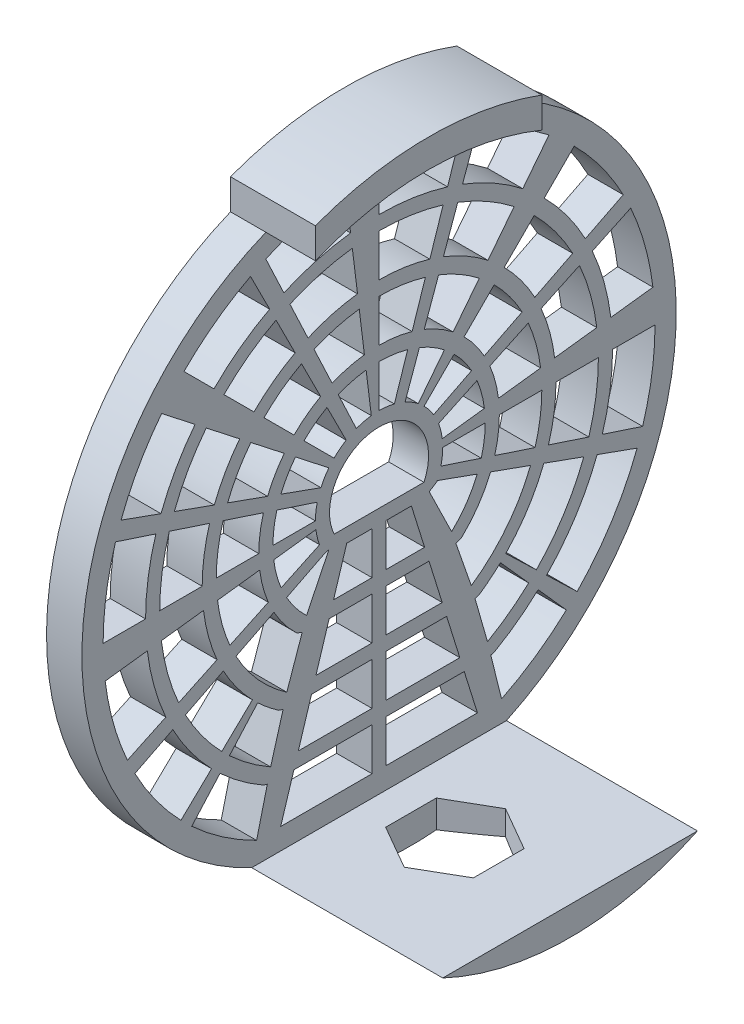
from build123d import *
from build123d.topology import SkipClean

# Parameters (mm, degrees)
EXTRUDE_START       = -8
EXTRUDE_3_DEPTH     = 16
SKETCH_4_R          = 1.5
CUT_EXTRUDE_3_DEPTH = 16
CUT_EXTRUDE_4_DEPTH = 190.330679157
EXTRUDE_START_2     = -2
EXTRUDE_4_DEPTH     = 2
EXTRUDE_START_3     = 2
EXTRUDE_5_DEPTH     = 2
CUT_EXTRUDE_START   = -2
CUT_EXTRUDE_5_DEPTH = 2
CUT_EXTRUDE_START_2 = 2
CUT_EXTRUDE_6_DEPTH = 2
EXTRUDE_6_DEPTH     = 6
SKETCH_13_R         = 20.278218111
EXTRUDE_9_DEPTH     = 2.5
EXTRUDE_10_DEPTH    = 2.5


# Read off the part's stored shape, not the designer's step: 填料-伸長3
with BuildPart() as part:
    # 填料-伸長3 outline → 填料-伸長3 (new body)
    with BuildSketch(Plane(origin=(-3, 0, 0), x_dir=(0, 0, -1), z_dir=(1, 0, 0)).offset(EXTRUDE_START)):
        with BuildLine():
            ThreePointArc((-189, -41.816711929), (-180, -43.843045968), (-171, -41.816711929))
            Line((-171, -41.816711929), (-189, -41.816711929))
        make_face()
    extrude(amount=EXTRUDE_3_DEPTH)

    # 草圖4 → 除料-伸長3 (cut)
    with BuildSketch(Plane(origin=(0, -41.816711929, 0), x_dir=(1, 0, 0), z_dir=(0, 1, 0))):
        with Locations(Location((-3.143386724, -180, 0), (0, 0, 270))):
            Circle(SKETCH_4_R)
    extrude(amount=-CUT_EXTRUDE_3_DEPTH, mode=Mode.SUBTRACT)

    # 草圖6 → 除料-伸長4 (cut, through all)
    with BuildSketch(Plane(origin=(0, -41.816711929, 0), x_dir=(1, 0, 0), z_dir=(0, 1, 0))):
        Polygon((-3.143386724, -176.420428331), (-6.243386724, -178.210214166), (-6.243386724, -181.789785834), (-3.143386724, -183.579571669), (-0.043386724, -181.789785834), (-0.043386724, -178.210214166), align=None)
    extrude(amount=-CUT_EXTRUDE_4_DEPTH, mode=Mode.SUBTRACT)

    # 草圖8 → 填料-伸長4 (add)
    with BuildSketch(Plane(origin=(-8.5, 0, 0), x_dir=(0, 0, -1), z_dir=(1, 0, 0)).offset(EXTRUDE_START_2)):
        with BuildLine():
            Line((-171, -41.816711929), (-189, -41.816711929))
            ThreePointArc((-189, -41.816711929), (-200.992879202, -22.296216192), (-188, -3.426558129))
            ThreePointArc((-188, -3.426558129), (-180, -1.843045968), (-172, -3.426558129))
            ThreePointArc((-172, -3.426558129), (-159.007120798, -22.296216192), (-171, -41.816711929))
        make_face()
    extrude(amount=EXTRUDE_4_DEPTH)

    # 草圖9 → 填料-伸長5 (add)
    with SkipClean():  # the faces are left unmerged after this step: merging them gives an invalid solid
        with BuildSketch(Plane.ZY.offset(10.5).offset(EXTRUDE_START_3)):
            with BuildLine():
                Line((171, -41.816711929), (189, -41.816711929))
                ThreePointArc((189, -41.816711929), (200.692845947, -26.421610847), (194.849242405, -7.993803563))
                ThreePointArc((194.849242405, -7.993803563), (162.837520815, -10.74142177), (171, -41.816711929))
            make_face()
            with BuildLine():
                Line((172.104683891, -37.255080469), (171.344308353, -40.316711929))
                ThreePointArc((171.344308353, -40.316711929), (163.431415463, -33.125652955), (160.5, -22.843045968))
                Line((160.5, -22.843045968), (163.5, -22.843045968))
                ThreePointArc((163.5, -22.843045968), (165.737566813, -31.139611497), (171.843393889, -37.185980701))
                Line((171.843393889, -37.185980701), (172.104683891, -37.255080469))
            make_face(mode=Mode.SUBTRACT)
            with BuildLine():
                Line((172.913939335, -33.140508969), (173.218364719, -33.235132513))
                Line((173.218364719, -33.235132513), (172.337733653, -36.316711929))
                ThreePointArc((172.337733653, -36.316711929), (166.601956703, -30.636789344), (164.5, -22.843045968))
                Line((164.5, -22.843045968), (167.5, -22.843045968))
                ThreePointArc((167.5, -22.843045968), (168.935964608, -28.660014323), (172.913939335, -33.140508969))
            make_face(mode=Mode.SUBTRACT)
            with BuildLine():
                Line((174.189084794, -29.046534057), (174.566816155, -29.195815975))
                Line((174.566816155, -29.195815975), (173.480824189, -32.316711929))
                ThreePointArc((173.480824189, -32.316711929), (169.821087439, -28.194656855), (168.5, -22.843045968))
                Line((168.5, -22.843045968), (171.5, -22.843045968))
                ThreePointArc((171.5, -22.843045968), (172.201193064, -26.223668747), (174.189084794, -29.046534057))
            make_face(mode=Mode.SUBTRACT)
            with BuildLine():
                Line((175.918326175, -24.737759347), (176.453174061, -25.079146753))
                Line((176.453174061, -25.079146753), (174.872721877, -28.316711929))
                ThreePointArc((174.872721877, -28.316711929), (173.118699762, -25.82594842), (172.5, -22.843045968))
                Line((172.5, -22.843045968), (175.5, -22.843045968))
                ThreePointArc((175.5, -22.843045968), (175.60582589, -23.813218063), (175.918326175, -24.737759347))
            make_face(mode=Mode.SUBTRACT)
            Polygon((186.01788988, -37.316711929), (186.951295427, -40.316711929), (173.048704573, -40.316711929), (173.98211012, -37.316711929), align=None, mode=Mode.SUBTRACT)
            Polygon((184.773349151, -33.316711929), (185.706754698, -36.316711929), (174.293245302, -36.316711929), (175.226650849, -33.316711929), align=None, mode=Mode.SUBTRACT)
            with BuildLine():
                ThreePointArc((199.354649957, -25.219498165), (195.909942648, -34.117961708), (188.655691647, -40.316711929))
                Line((188.655691647, -40.316711929), (187.895316109, -37.255080469))
                Line((187.895316109, -37.255080469), (188.156606111, -37.185980701))
                ThreePointArc((188.156606111, -37.185980701), (193.729337666, -31.994837447), (196.377011502, -24.853890134))
                Line((196.377011502, -24.853890134), (199.354649957, -25.219498165))
            make_face(mode=Mode.SUBTRACT)
            Polygon((183.528808422, -29.316711929), (184.462213969, -32.316711929), (175.537786031, -32.316711929), (176.471191578, -29.316711929), align=None, mode=Mode.SUBTRACT)
            with BuildLine():
                ThreePointArc((191.414280744, -24.244543417), (189.833218808, -28.806082768), (186.519175811, -32.316711929))
                Line((186.519175811, -32.316711929), (185.433183845, -29.195815975))
                Line((185.433183845, -29.195815975), (185.810915206, -29.046534057))
                ThreePointArc((185.810915206, -29.046534057), (187.577878506, -26.693468978), (188.436642289, -23.878935387))
                Line((188.436642289, -23.878935387), (191.414280744, -24.244543417))
            make_face(mode=Mode.SUBTRACT)
            Polygon((182.284267693, -25.316711929), (183.21767324, -28.316711929), (176.78232676, -28.316711929), (177.715732307, -25.316711929), align=None, mode=Mode.SUBTRACT)
            with BuildLine():
                ThreePointArc((187.444096137, -23.757066044), (186.686363387, -26.240478036), (185.127278123, -28.316711929))
                Line((185.127278123, -28.316711929), (183.546825939, -25.079146753))
                Line((183.546825939, -25.079146753), (184.081673825, -24.737759347))
                ThreePointArc((184.081673825, -24.737759347), (184.3267505, -24.079666408), (184.466457682, -23.391458013))
                Line((184.466457682, -23.391458013), (187.444096137, -23.757066044))
            make_face(mode=Mode.SUBTRACT)
            with BuildLine():
                ThreePointArc((195.38446535, -24.732020791), (192.897256595, -31.440183418), (187.662266347, -36.316711929))
                Line((187.662266347, -36.316711929), (186.781635281, -33.235132513))
                Line((186.781635281, -33.235132513), (187.086060665, -33.140508969))
                ThreePointArc((187.086060665, -33.140508969), (190.688281313, -29.324607707), (192.406826896, -24.366412761))
                Line((192.406826896, -24.366412761), (195.38446535, -24.732020791))
            make_face(mode=Mode.SUBTRACT)
            with BuildLine():
                ThreePointArc((168.33273811, -11.175784079), (165.169898236, -15.609922046), (163.622988498, -20.832201802))
                Line((163.622988498, -20.832201802), (160.645350043, -20.466593772))
                ThreePointArc((160.645350043, -20.466593772), (162.473516097, -14.294808606), (166.211417767, -9.054463735))
                Line((166.211417767, -9.054463735), (168.33273811, -11.175784079))
            make_face(mode=Mode.SUBTRACT)
            with BuildLine():
                ThreePointArc((171.161165235, -14.004211203), (168.765074421, -17.363406633), (167.593173104, -21.319679176))
                Line((167.593173104, -21.319679176), (164.61553465, -20.954071145))
                ThreePointArc((164.61553465, -20.954071145), (166.068692282, -16.048293193), (169.039844892, -11.88289086))
                Line((169.039844892, -11.88289086), (171.161165235, -14.004211203))
            make_face(mode=Mode.SUBTRACT)
            with BuildLine():
                Line((174.696699141, -17.539745109), (176.818019485, -19.661065453))
                ThreePointArc((176.818019485, -19.661065453), (175.955426792, -20.870375808), (175.533542318, -22.294633923))
                Line((175.533542318, -22.294633923), (172.555903863, -21.929025893))
                ThreePointArc((172.555903863, -21.929025893), (173.259044653, -19.555262367), (174.696699141, -17.539745109))
            make_face(mode=Mode.SUBTRACT)
            with BuildLine():
                ThreePointArc((173.98959236, -16.832638328), (172.360250606, -19.11689122), (171.563357711, -21.807156549))
                Line((171.563357711, -21.807156549), (168.585719256, -21.441548519))
                ThreePointArc((168.585719256, -21.441548519), (169.663868468, -17.80177778), (171.868272016, -14.711317984))
                Line((171.868272016, -14.711317984), (173.98959236, -16.832638328))
            make_face(mode=Mode.SUBTRACT)
            with BuildLine():
                Line((180, -15.343045968), (180, -18.343045968))
                ThreePointArc((180, -18.343045968), (178.534943305, -18.588212378), (177.229523361, -19.296997577))
                Line((177.229523361, -19.296997577), (175.382538935, -16.932965316))
                ThreePointArc((175.382538935, -16.932965316), (177.558238842, -15.751656651), (180, -15.343045968))
            make_face(mode=Mode.SUBTRACT)
            with BuildLine():
                Line((174.76687746, -16.144954562), (172.919893034, -13.780922302))
                ThreePointArc((172.919893034, -13.780922302), (176.255966224, -11.969582349), (180, -11.343045968))
                Line((180, -11.343045968), (180, -14.343045968))
                ThreePointArc((180, -14.343045968), (177.232670687, -14.806138076), (174.76687746, -16.144954562))
            make_face(mode=Mode.SUBTRACT)
            with BuildLine():
                Line((172.304231558, -12.992911548), (170.457247132, -10.628879287))
                ThreePointArc((170.457247132, -10.628879287), (174.953693606, -8.187508046), (180, -7.343045968))
                Line((180, -7.343045968), (180, -10.343045968))
                ThreePointArc((180, -10.343045968), (175.930398069, -11.024063773), (172.304231558, -12.992911548))
            make_face(mode=Mode.SUBTRACT)
            with BuildLine():
                Line((169.841585657, -9.840868534), (167.994601231, -7.476836273))
                ThreePointArc((167.994601231, -7.476836273), (173.651420988, -4.405433744), (180, -3.343045968))
                Line((180, -3.343045968), (180, -6.343045968))
                ThreePointArc((180, -6.343045968), (174.628125451, -7.241989471), (169.841585657, -9.840868534))
            make_face(mode=Mode.SUBTRACT)
            with BuildLine():
                ThreePointArc((183.473911531, -23.26958867), (183.365250389, -23.804861866), (183.174635197, -24.316711929))
                Line((183.174635197, -24.316711929), (176.825364803, -24.316711929))
                ThreePointArc((176.825364803, -24.316711929), (176.582309026, -23.597624264), (176.5, -22.843045968))
                ThreePointArc((176.5, -22.843045968), (176.506528206, -22.62937608), (176.526088469, -22.416503266))
                ThreePointArc((176.526088469, -22.416503266), (176.854220838, -21.308746954), (177.525126266, -20.368172234))
                ThreePointArc((177.525126266, -20.368172234), (177.680829831, -20.221700945), (177.845184836, -20.08500833))
                ThreePointArc((177.845184836, -20.08500833), (178.860511459, -19.533730954), (180, -19.343045968))
                ThreePointArc((180, -19.343045968), (180.213669888, -19.349574174), (180.426542702, -19.369134437))
                ThreePointArc((180.426542702, -19.369134437), (181.534299014, -19.697266806), (182.474873734, -20.368172234))
                ThreePointArc((182.474873734, -20.368172234), (182.621345023, -20.523875799), (182.758037638, -20.688230804))
                ThreePointArc((182.758037638, -20.688230804), (183.309315015, -21.703557428), (183.5, -22.843045968))
                ThreePointArc((183.5, -22.843045968), (183.493471794, -23.056715856), (183.473911531, -23.26958867))
            make_face(mode=Mode.SUBTRACT)
            with BuildLine():
                Line((185.303300859, -17.539745109), (183.181980515, -19.661065453))
                ThreePointArc((183.181980515, -19.661065453), (181.972670161, -18.79847276), (180.548412045, -18.376588286))
                Line((180.548412045, -18.376588286), (180.914020076, -15.398949831))
                ThreePointArc((180.914020076, -15.398949831), (183.287783601, -16.102090621), (185.303300859, -17.539745109))
            make_face(mode=Mode.SUBTRACT)
            with BuildLine():
                Line((187.5, -22.843045968), (184.5, -22.843045968))
                ThreePointArc((184.5, -22.843045968), (184.25483359, -21.377989273), (183.546048391, -20.072569329))
                Line((183.546048391, -20.072569329), (185.910080652, -18.225584903))
                ThreePointArc((185.910080652, -18.225584903), (187.091389317, -20.40128481), (187.5, -22.843045968))
            make_face(mode=Mode.SUBTRACT)
            with BuildLine():
                Line((191.5, -22.843045968), (188.5, -22.843045968))
                ThreePointArc((188.5, -22.843045968), (188.036907893, -20.075716655), (186.698091406, -17.609923428))
                Line((186.698091406, -17.609923428), (189.062123666, -15.762939002))
                ThreePointArc((189.062123666, -15.762939002), (190.873463619, -19.099012192), (191.5, -22.843045968))
            make_face(mode=Mode.SUBTRACT)
            with BuildLine():
                Line((188.131727984, -14.711317984), (186.01040764, -16.832638328))
                ThreePointArc((186.01040764, -16.832638328), (183.726154748, -15.203296575), (181.035889419, -14.406403679))
                Line((181.035889419, -14.406403679), (181.401497449, -11.428765224))
                ThreePointArc((181.401497449, -11.428765224), (185.041268188, -12.506914436), (188.131727984, -14.711317984))
            make_face(mode=Mode.SUBTRACT)
            with BuildLine():
                Line((195.5, -22.843045968), (192.5, -22.843045968))
                ThreePointArc((192.5, -22.843045968), (191.818982195, -18.773444037), (189.85013442, -15.147277527))
                Line((189.85013442, -15.147277527), (192.214166681, -13.300293101))
                ThreePointArc((192.214166681, -13.300293101), (194.655537922, -17.796739574), (195.5, -22.843045968))
            make_face(mode=Mode.SUBTRACT)
            with BuildLine():
                Line((199.5, -22.843045968), (196.5, -22.843045968))
                ThreePointArc((196.5, -22.843045968), (195.601056497, -17.47117142), (193.002177435, -12.684631625))
                Line((193.002177435, -12.684631625), (195.366209695, -10.837647199))
                ThreePointArc((195.366209695, -10.837647199), (198.437612224, -16.494466956), (199.5, -22.843045968))
            make_face(mode=Mode.SUBTRACT)
            with BuildLine():
                Line((190.960155108, -11.88289086), (188.838834765, -14.004211203))
                ThreePointArc((188.838834765, -14.004211203), (185.479639335, -11.608120389), (181.523366793, -10.436219073))
                Line((181.523366793, -10.436219073), (181.888974823, -7.458580618))
                ThreePointArc((181.888974823, -7.458580618), (186.794752775, -8.91173825), (190.960155108, -11.88289086))
            make_face(mode=Mode.SUBTRACT)
            with BuildLine():
                Line((193.788582233, -9.054463735), (191.66726189, -11.175784079))
                ThreePointArc((191.66726189, -11.175784079), (187.233123922, -8.012944204), (182.010844166, -6.466034466))
                Line((182.010844166, -6.466034466), (182.376452196, -3.488396011))
                ThreePointArc((182.376452196, -3.488396011), (188.548237362, -5.316562065), (193.788582233, -9.054463735))
            make_face(mode=Mode.SUBTRACT)
        extrude_5 = extrude(amount=-EXTRUDE_5_DEPTH)

    # 草圖10 → 除料-伸長5 (cut)
    with BuildSketch(Plane(origin=(-8.5, 0, 0), x_dir=(0, 0, -1), z_dir=(1, 0, 0)).offset(CUT_EXTRUDE_START)):
        with BuildLine():
            Line((-189, -41.816711929), (-171, -41.816711929))
            ThreePointArc((-171, -41.816711929), (-180, -1.843045968), (-189, -41.816711929))
        make_face()
    extrude(amount=CUT_EXTRUDE_5_DEPTH, mode=Mode.SUBTRACT)

    # 鏡射1: 填料-伸長5 across plane
    with SkipClean():  # the faces are left unmerged after this step: merging them gives an invalid solid
        add(extrude_5.mirror(Plane(origin=(-10.5, 0, 0), x_dir=(0, 0, 1), z_dir=(1, 0, 0))))

    # 草圖11 → 除料-伸長6 (cut)
    with SkipClean():  # the faces are left unmerged after this step: merging them gives an invalid solid
        with BuildSketch(Plane.ZY.offset(11).offset(CUT_EXTRUDE_START_2)):
            with BuildLine():
                ThreePointArc((189, -41.816711929), (180, -1.843045968), (171, -41.816711929))
                Line((171, -41.816711929), (189, -41.816711929))
            make_face()
        extrude(amount=-CUT_EXTRUDE_6_DEPTH, mode=Mode.SUBTRACT)

    # 草圖12 → 填料-伸長6 (add)
    with SkipClean():  # the faces are left unmerged after this step: merging them gives an invalid solid
        with BuildSketch(Plane.ZY.offset(11)):
            with BuildLine():
                Line((188, -1.279187315), (188, -3.426558129))
                ThreePointArc((188, -3.426558129), (180, -1.843045968), (172, -3.426558129))
                Line((172, -3.426558129), (172, -1.279187315))
                ThreePointArc((172, -1.279187315), (180, 0.156954032), (188, -1.279187315))
            make_face()
        extrude(amount=-EXTRUDE_6_DEPTH)

    # 草圖13 → 填料-伸長9 (add)
    with SkipClean():  # the faces are left unmerged after this step: merging them gives an invalid solid
        with BuildSketch(Plane.ZY.offset(11)):
            with Locations((180, -22.843045968)):
                Circle(SKETCH_13_R)
            with BuildLine():
                Line((189.083403464, -5.587850185), (182.32403926, -18.98962651))
                ThreePointArc((182.32403926, -18.98962651), (181.972670161, -18.79847276), (181.605714532, -18.639276131))
                Line((181.605714532, -18.639276131), (188.004978255, -5.061867066))
                ThreePointArc((188.004978255, -5.061867066), (181.190446521, -3.379417399), (174.221670237, -4.218843834))
                Line((174.221670237, -4.218843834), (178.918564891, -18.474923018))
                ThreePointArc((178.918564891, -18.474923018), (178.534943305, -18.588212378), (178.162897476, -18.735120176))
                Line((178.162897476, -18.735120176), (173.087182229, -4.609479382))
                ThreePointArc((173.087182229, -4.609479382), (167.07890906, -8.238409413), (162.744804217, -13.759642504))
                Line((162.744804217, -13.759642504), (176.146580542, -20.519006709))
                ThreePointArc((176.146580542, -20.519006709), (175.955426792, -20.870375808), (175.796230163, -21.237331436))
                Line((175.796230163, -21.237331436), (162.218821098, -14.838067713))
                ThreePointArc((162.218821098, -14.838067713), (160.536371431, -21.652599447), (161.375797866, -28.621375732))
                Line((161.375797866, -28.621375732), (175.63187705, -23.924481077))
                ThreePointArc((175.63187705, -23.924481077), (175.74516641, -24.308102663), (175.892074208, -24.680148492))
                Line((175.892074208, -24.680148492), (161.766433414, -29.755863739))
                ThreePointArc((161.766433414, -29.755863739), (168.177425556, -38.350358228), (178.162897476, -42.256316025))
                Line((178.162897476, -42.256316025), (179.5, -40.316711929))
                Line((179.5, -40.316711929), (179.5, -25.316711929))
                Line((179.5, -25.316711929), (180.5, -25.316711929))
                Line((180.5, -25.316711929), (180.5, -40.316711929))
                Line((180.5, -40.316711929), (181.605714532, -42.276822771))
                ThreePointArc((181.605714532, -42.276822771), (190.757139097, -39.107545913), (197.255195783, -31.926449432))
                Line((197.255195783, -31.926449432), (183.853419458, -25.167085228))
                Line((183.853419458, -25.167085228), (183.546825939, -25.079146753))
                Line((183.546825939, -25.079146753), (184.203769837, -24.4487605))
                Line((184.203769837, -24.4487605), (197.781178902, -30.848024223))
                ThreePointArc((197.781178902, -30.848024223), (199.463628569, -24.033492489), (198.624202134, -17.064716205))
                Line((198.624202134, -17.064716205), (184.36812295, -21.761610859))
                ThreePointArc((184.36812295, -21.761610859), (184.25483359, -21.377989273), (184.107925792, -21.005943444))
                Line((184.107925792, -21.005943444), (198.233566586, -15.930228197))
                ThreePointArc((198.233566586, -15.930228197), (194.604636555, -9.921955028), (189.083403464, -5.587850185))
            make_face(mode=Mode.SUBTRACT)
        extrude(amount=-EXTRUDE_9_DEPTH)

    # 草圖14 → 填料-伸長10 (add)
    with SkipClean():  # the faces are left unmerged after this step: merging them gives an invalid solid
        with BuildSketch(Plane(origin=(-8.5, 0, 0), x_dir=(0, 0, -1), z_dir=(1, 0, 0))):
            Polygon((-194.000621255, -36.416277141), (-191.837220515, -34.337836548), (-188.58285603, -31.21127607), (-188.244010571, -31.56397247), (-193.508602942, -37.465431579), (-194.890320943, -36.482732254), align=None)
            Polygon((-166.491397058, -37.465431579), (-165.109679057, -36.482732254), (-165.999378745, -36.416277141), (-168.162779485, -34.337836548), (-171.41714397, -31.21127607), (-171.755989429, -31.56397247), align=None)
        extrude(amount=-EXTRUDE_10_DEPTH)


solid = part.part
